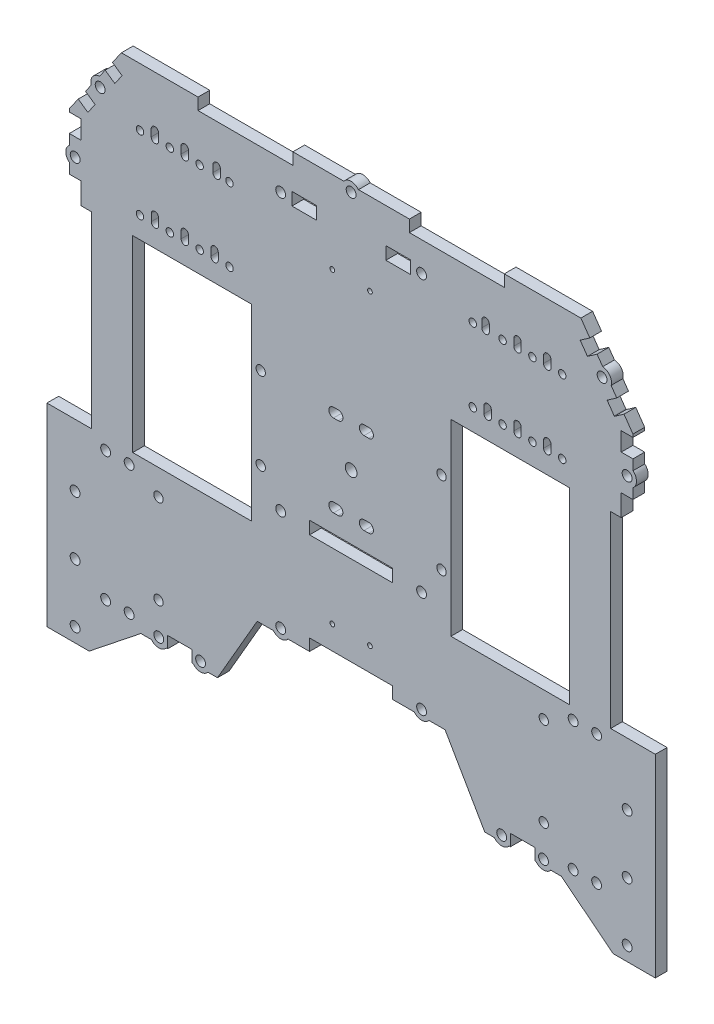
from build123d import *

# Parameters (mm, degrees)
BOSS_EXTRUDE1_DEPTH      = 5
CUT_EXTRUDE1_DEPTH       = 5
CUT_EXTRUDE4_DEPTH       = 5
BOSS_EXTRUDE3_DEPTH      = 5
SKETCH8_R                = 2.1
SKETCH8_W                = 5
SKETCH8_H                = 7.5
SKETCH8_W_2              = 40
SKETCH8_H_2              = 5
CUT_EXTRUDE5_DEPTH       = 10
BOSS_EXTRUDE4_DEPTH      = 5
SKETCH11_W               = 17.5
SKETCH11_H               = 80
BOSS_EXTRUDE5_DEPTH      = 5
CUT_EXTRUDE7_START       = -5
CUT_EXTRUDE7_OUTLINE_W   = 35.4
CUT_EXTRUDE7_OUTLINE_H   = 5
CUT_EXTRUDE7_OUTLINE_W_2 = 10.4
CUT_EXTRUDE7_OUTLINE_W_3 = 35
CUT_EXTRUDE7_DEPTH       = 5
SKETCH14_R               = 2.1
CUT_EXTRUDE8_DEPTH       = 5
SKETCH15_R               = 2.1
CUT_EXTRUDE9_DEPTH       = 5
BOSS_EXTRUDE6_DEPTH      = 5
SKETCH18_W               = 35.4
SKETCH18_H               = 5.4
CUT_EXTRUDE10_DEPTH      = 5
SKETCH20_R               = 2.1
CUT_EXTRUDE12_DEPTH      = 10
BOSS_EXTRUDE7_DEPTH      = 5
SKETCH22_R               = 2.1
CUT_EXTRUDE13_DEPTH      = 10
CUT_EXTRUDE14_START      = -10
SKETCH12_R               = 2.1
SKETCH12_W               = 10.4
SKETCH12_H               = 5.4
SKETCH12_W_2             = 5
SKETCH12_H_2             = 7.9
SKETCH12_W_3             = 40.4
SKETCH12_H_3             = 5
CUT_EXTRUDE14_DEPTH      = 10
SKETCH26_R               = 2.1
CUT_EXTRUDE16_DEPTH      = 10
SKETCH27_R               = 2
CUT_EXTRUDE17_DEPTH      = 10
CUT_EXTRUDE18_START      = -10
CUT_EXTRUDE18_DEPTH      = 10
SKETCH30_R               = 2.5
CUT_EXTRUDE19_DEPTH      = 10
SKETCH32_R               = 1.59
CUT_EXTRUDE20_DEPTH      = 10
SKETCH33_R               = 1
CUT_EXTRUDE21_DEPTH      = 10
SKETCH35_R               = 2
CUT_EXTRUDE22_DEPTH      = 10
SKETCH37_R               = 1.59
CUT_EXTRUDE23_DEPTH      = 10
SKETCH38_R               = 1.59
CUT_EXTRUDE24_DEPTH      = 10
CUT_EXTRUDE25_DEPTH      = 10
SKETCH40_W               = 5
SKETCH40_H               = 1.259948687
CUT_EXTRUDE26_DEPTH      = 10


# Read off the part's stored shape, not the designer's step: Cut-Extrude7
with BuildPart() as part:
    # Sketch1 → Boss-Extrude1 (new body)
    with BuildSketch(Plane.XY):
        Polygon((-120, 40), (-42.5, 40), (-42.5, -40), (-120, -40), (-120, -105), (120, -105), (120, -40), (42.5, -40), (42.5, 40), (120, 40), (120, 105), (-120, 105), align=None)
    extrude(amount=BOSS_EXTRUDE1_DEPTH)

    # Sketch2 → Cut-Extrude1 (cut)
    with BuildSketch(Plane.XY.offset(5)):
        Polygon((40, -75.717967697), (-40, -75.717967697), (-80, -145), (-40, -214.282032303), (40, -214.282032303), (80, -145), align=None)
    extrude(amount=-CUT_EXTRUDE1_DEPTH, mode=Mode.SUBTRACT)

    # Sketch5 → Cut-Extrude4 (cut)
    with BuildSketch(Plane.XY.offset(5)):
        Polygon((-97.823934729, 105), (-120, 73.319897373), (-120, 105), align=None)
        Polygon((97.823934729, 105), (120, 105), (120, 73.319897373), align=None)
    extrude(amount=-CUT_EXTRUDE4_DEPTH, mode=Mode.SUBTRACT)

    # Sketch7 → Boss-Extrude3 (add)
    with BuildSketch(Plane(origin=(0, 0, 0), x_dir=(-1, 0, 0), z_dir=(0, 0, -1))):
        Polygon((120, -40), (120, -105), (89.53, -105), (111.53, -122.5), (129.53, -122.5), (129.53, -40), align=None)
    boss_extrude3 = extrude(amount=-BOSS_EXTRUDE3_DEPTH)

    # Mirror2: Boss-Extrude3 across plane
    add(boss_extrude3.mirror(Plane(origin=(0, 0, 0), x_dir=(0, 0, 1), z_dir=(1, 0, 0))))

    # Sketch8 → Cut-Extrude5 (cut)
    with BuildSketch(Plane.XY.offset(5)):
        with Locations((0, 102.5)):
            Circle(SKETCH8_R)
        with Locations((106.863887364, 87.726293111)):
            Circle(SKETCH8_R)
        with Locations((117.5, 56.659948687)):
            Circle(SKETCH8_R)
        with Locations(Location((-117.5, 56.659948687, 0), (0, 0, 180))):
            Circle(SKETCH8_R)
        with Locations(Location((-106.863887364, 87.726293111, 0), (0, 0, 180))):
            Circle(SKETCH8_R)
        Polygon((-113.212934092, 83.015708684), (-116.080245244, 78.919548683), (-111.984085243, 76.052237531), (-109.116774091, 80.148397532), align=None)
        Polygon((-100.514840635, 92.436877537), (-104.611000637, 95.304188689), (-101.743689485, 99.400348691), (-97.647529483, 96.533037539), align=None)
        with Locations((-117.5, 45.409948687)):
            Rectangle(SKETCH8_W, SKETCH8_H)
        with Locations((-117.5, 67.909948687)):
            Rectangle(SKETCH8_W, SKETCH8_H)
        with Locations((-45, 102.5)):
            Rectangle(SKETCH8_W_2, SKETCH8_H_2)
        with Locations((45, 102.5)):
            Rectangle(SKETCH8_W_2, SKETCH8_H_2)
        with Locations((117.5, 67.909948687)):
            Rectangle(SKETCH8_W, SKETCH8_H)
        with Locations((117.5, 45.409948687)):
            Rectangle(SKETCH8_W, SKETCH8_H)
        Polygon((104.611000637, 95.304188689), (101.743689485, 99.400348691), (97.647529483, 96.533037539), (100.514840635, 92.436877537), align=None)
        Polygon((109.116774091, 80.148397532), (113.212934092, 83.015708684), (116.080245244, 78.919548683), (111.984085243, 76.052237531), align=None)
    extrude(amount=-CUT_EXTRUDE5_DEPTH, mode=Mode.SUBTRACT)

    # Sketch9 → Boss-Extrude4 (add)
    with BuildSketch(Plane.XY.offset(5)):
        with BuildLine():
            Line((-3.122498999, 105), (3.122498999, 105))
            ThreePointArc((3.122498999, 105), (0, 106.5), (-3.122498999, 105))
        make_face()
        with BuildLine():
            Line((107.121332124, 91.717999788), (110.702602605, 86.601897586))
            ThreePointArc((110.702602605, 86.601897586), (110.140815365, 90.020142032), (107.121332124, 91.717999788))
        make_face()
        with BuildLine():
            Line((120, 59.782447686), (120, 53.537449687))
            ThreePointArc((120, 53.537449687), (121.5, 56.659948687), (120, 59.782447686))
        make_face()
        with BuildLine():
            Line((-120, 59.782447686), (-120, 53.537449687))
            ThreePointArc((-120, 53.537449687), (-121.5, 56.659948687), (-120, 59.782447686))
        make_face()
        with BuildLine():
            Line((-107.121332124, 91.717999788), (-110.702602605, 86.601897586))
            ThreePointArc((-110.702602605, 86.601897586), (-110.140815365, 90.020142032), (-107.121332124, 91.717999788))
        make_face()
    extrude(amount=-BOSS_EXTRUDE4_DEPTH)

    # Sketch11 → Boss-Extrude5 (add)
    with BuildSketch(Plane(origin=(0, 0, 0), x_dir=(-1, 0, 0), z_dir=(0, 0, -1))):
        with Locations((101.75, 0)):
            Rectangle(SKETCH11_W, SKETCH11_H)
        with Locations((-101.75, 0)):
            Rectangle(SKETCH11_W, SKETCH11_H)
    extrude(amount=-BOSS_EXTRUDE5_DEPTH)

    # Cut-Extrude7 outline → Cut-Extrude7 (cut)
    with BuildSketch(Plane(origin=(0, 0, 0), x_dir=(-1, 0, 0), z_dir=(0, 0, -1)).offset(CUT_EXTRUDE7_START)):
        with Locations((0, -73.217967697)):
            Rectangle(CUT_EXTRUDE7_OUTLINE_W, CUT_EXTRUDE7_OUTLINE_H)
        with Locations((-73, -102.5)):
            Rectangle(CUT_EXTRUDE7_OUTLINE_W_2, CUT_EXTRUDE7_OUTLINE_H)
        with Locations((73, -102.5)):
            Rectangle(CUT_EXTRUDE7_OUTLINE_W_2, CUT_EXTRUDE7_OUTLINE_H)
        with Locations((0, -30)):
            Rectangle(CUT_EXTRUDE7_OUTLINE_W_3, CUT_EXTRUDE7_OUTLINE_H)
    extrude(amount=CUT_EXTRUDE7_DEPTH, mode=Mode.SUBTRACT)

    # Sketch14 → Cut-Extrude8 (cut)
    with BuildSketch(Plane(origin=(0, 0, 0), x_dir=(-1, 0, 0), z_dir=(0, 0, -1))):
        with Locations((-30, 87.5)):
            Circle(SKETCH14_R)
        with Locations((30, 87.5)):
            Circle(SKETCH14_R)
    extrude(amount=-CUT_EXTRUDE8_DEPTH, mode=Mode.SUBTRACT)

    # Sketch15 → Cut-Extrude9 (cut)
    with BuildSketch(Plane(origin=(0, 0, 0), x_dir=(-1, 0, 0), z_dir=(0, 0, -1))):
        with Locations((30, -73.217967697)):
            Circle(SKETCH15_R)
        with Locations((-30, -73.217967697)):
            Circle(SKETCH15_R)
    extrude(amount=-CUT_EXTRUDE9_DEPTH, mode=Mode.SUBTRACT)

    # Sketch16 → Boss-Extrude6 (add)
    with BuildSketch(Plane(origin=(0, 0, 0), x_dir=(-1, 0, 0), z_dir=(0, 0, -1))):
        with BuildLine():
            Line((-33.122498999, -75.717967697), (-26.877501001, -75.717967697))
            ThreePointArc((-26.877501001, -75.717967697), (-30, -77.217967697), (-33.122498999, -75.717967697))
        make_face()
        with BuildLine():
            Line((26.877501001, -75.717967697), (33.122498999, -75.717967697))
            ThreePointArc((33.122498999, -75.717967697), (30, -77.217967697), (26.877501001, -75.717967697))
        make_face()
    extrude(amount=-BOSS_EXTRUDE6_DEPTH)

    # Sketch18 → Cut-Extrude10 (cut)
    with BuildSketch(Plane(origin=(0, 0, 0), x_dir=(-1, 0, 0), z_dir=(0, 0, -1))):
        with Locations((0, -30)):
            Rectangle(SKETCH18_W, SKETCH18_H)
    extrude(amount=-CUT_EXTRUDE10_DEPTH, mode=Mode.SUBTRACT)

    # Sketch20 → Cut-Extrude12 (cut)
    with BuildSketch(Plane(origin=(0, 0, 0), x_dir=(-1, 0, 0), z_dir=(0, 0, -1))):
        with Locations((-64.1, -102.5)):
            Circle(SKETCH20_R)
        with Locations((-81.9, -102.5)):
            Circle(SKETCH20_R)
        with Locations((81.9, -102.5)):
            Circle(SKETCH20_R)
        with Locations((64.1, -102.5)):
            Circle(SKETCH20_R)
    extrude(amount=-CUT_EXTRUDE12_DEPTH, mode=Mode.SUBTRACT)

    # Sketch21 → Boss-Extrude7 (add)
    with BuildSketch(Plane(origin=(0, 0, 0), x_dir=(-1, 0, 0), z_dir=(0, 0, -1))):
        with BuildLine():
            Line((-85.022498999, -105), (-78.777501001, -105))
            ThreePointArc((-78.777501001, -105), (-81.9, -106.5), (-85.022498999, -105))
        make_face()
        with BuildLine():
            Line((-60.977501001, -105), (-67.222498999, -105))
            ThreePointArc((-67.222498999, -105), (-64.1, -106.5), (-60.977501001, -105))
        make_face()
        with BuildLine():
            Line((60.977501001, -105), (67.222498999, -105))
            ThreePointArc((67.222498999, -105), (64.1, -106.5), (60.977501001, -105))
        make_face()
        with BuildLine():
            Line((85.022498999, -105), (78.777501001, -105))
            ThreePointArc((78.777501001, -105), (81.9, -106.5), (85.022498999, -105))
        make_face()
    extrude(amount=-BOSS_EXTRUDE7_DEPTH)

    # Sketch22 → Cut-Extrude13 (cut)
    with BuildSketch(Plane(origin=(0, 0, 0), x_dir=(-1, 0, 0), z_dir=(0, 0, -1))):
        with Locations((-30, -30)):
            Circle(SKETCH22_R)
        with Locations((30, -30)):
            Circle(SKETCH22_R)
    extrude(amount=-CUT_EXTRUDE13_DEPTH, mode=Mode.SUBTRACT)

    # Sketch12 → Cut-Extrude14 (cut)
    with BuildSketch(Plane(origin=(0, 0, 0), x_dir=(-1, 0, 0), z_dir=(0, 0, -1)).offset(CUT_EXTRUDE14_START)):
        with Locations(Location((-117.5, 56.659948687, 0), (0, 0, 180))):
            Circle(SKETCH12_R)
        with Locations((117.5, 56.659948687)):
            Circle(SKETCH12_R)
        with Locations((-20, 87.5)):
            Rectangle(SKETCH12_W, SKETCH12_H)
        with Locations((20, 87.5)):
            Rectangle(SKETCH12_W, SKETCH12_H)
        with Locations((-117.5, 68.109948687)):
            Rectangle(SKETCH12_W_2, SKETCH12_H_2)
        with Locations((-117.5, 45.209948687)):
            Rectangle(SKETCH12_W_2, SKETCH12_H_2)
        Polygon((-101.628998624, 99.564192826), (-97.532838623, 96.696881674), (-100.629534667, 92.273028872), (-104.725694668, 95.140340024), align=None)
        with Locations((117.5, 45.209948687)):
            Rectangle(SKETCH12_W_2, SKETCH12_H_2)
        Polygon((-113.098249115, 83.179569765), (-116.194953969, 78.75572313), (-112.098799678, 75.888403821), (-109.002094824, 80.312250455), align=None)
        with Locations((-45, 102.5)):
            Rectangle(SKETCH12_W_3, SKETCH12_H_3)
        with Locations((45, 102.5)):
            Rectangle(SKETCH12_W_3, SKETCH12_H_3)
        with Locations((117.5, 68.109948687)):
            Rectangle(SKETCH12_W_2, SKETCH12_H_2)
        Polygon((116.194953969, 78.75572313), (112.098799678, 75.888403821), (109.002094824, 80.312250455), (113.098249115, 83.179569765), align=None)
        Polygon((104.725694668, 95.140340024), (101.628998624, 99.564192826), (97.532838623, 96.696881674), (100.629534667, 92.273028872), align=None)
    extrude(amount=CUT_EXTRUDE14_DEPTH, mode=Mode.SUBTRACT)

    # Sketch26 → Cut-Extrude16 (cut)
    with BuildSketch(Plane.XY.offset(5)):
        with Locations((-104.53, -100)):
            Circle(SKETCH26_R)
        with Locations((-94.53, -100)):
            Circle(SKETCH26_R)
        with Locations((-117.53, -116.5)):
            Circle(SKETCH26_R)
        with Locations((-117.53, -91.5)):
            Circle(SKETCH26_R)
        with Locations((-117.53, -66.5)):
            Circle(SKETCH26_R)
        with Locations((-104.53, -45)):
            Circle(SKETCH26_R)
        with Locations((-94.53, -45)):
            Circle(SKETCH26_R)
    cut_extrude16 = extrude(amount=-CUT_EXTRUDE16_DEPTH, mode=Mode.SUBTRACT)

    # Mirror3: Cut-Extrude16 across plane
    add(cut_extrude16.mirror(Plane(origin=(0, 0, 0), x_dir=(0, 0, 1), z_dir=(1, 0, 0))), mode=Mode.SUBTRACT)

    # Sketch27 → Cut-Extrude17 (cut)
    with BuildSketch(Plane.XY.offset(5)):
        with Locations((7.5, 17.5)):
            Circle(SKETCH27_R)
        with Locations((38.5, 17.5)):
            Circle(SKETCH27_R)
        with Locations((38.5, -17.5)):
            Circle(SKETCH27_R)
        with Locations((7.5, -17.5)):
            Circle(SKETCH27_R)
    cut_extrude17 = extrude(amount=-CUT_EXTRUDE17_DEPTH, mode=Mode.SUBTRACT)

    # Mirror4: Cut-Extrude17 across plane
    add(cut_extrude17.mirror(Plane(origin=(0, 0, 0), x_dir=(0, 0, 1), z_dir=(1, 0, 0))), mode=Mode.SUBTRACT)

    # Sketch29 → Cut-Extrude18 (cut)
    with BuildSketch(Plane(origin=(0, 0, 0), x_dir=(-1, 0, 0), z_dir=(0, 0, -1)).offset(CUT_EXTRUDE18_START)):
        with BuildLine():
            Line((5.5, 19.5), (7.5, 19.5))
            ThreePointArc((7.5, 19.5), (9.5, 17.5), (7.5, 15.5))
            Line((7.5, 15.5), (5.5, 15.5))
            ThreePointArc((5.5, 15.5), (3.5, 17.5), (5.5, 19.5))
        make_face()
        with BuildLine():
            Line((-7.5, 15.5), (-5.5, 15.5))
            ThreePointArc((-5.5, 15.5), (-3.5, 17.5), (-5.5, 19.5))
            Line((-5.5, 19.5), (-7.5, 19.5))
            ThreePointArc((-7.5, 19.5), (-9.5, 17.5), (-7.5, 15.5))
        make_face()
        with BuildLine():
            Line((-5.5, -19.5), (-7.5, -19.5))
            ThreePointArc((-7.5, -19.5), (-9.5, -17.5), (-7.5, -15.5))
            Line((-7.5, -15.5), (-5.5, -15.5))
            ThreePointArc((-5.5, -15.5), (-3.5, -17.5), (-5.5, -19.5))
        make_face()
        with BuildLine():
            Line((7.5, -15.5), (5.5, -15.5))
            ThreePointArc((5.5, -15.5), (3.5, -17.5), (5.5, -19.5))
            Line((5.5, -19.5), (7.5, -19.5))
            ThreePointArc((7.5, -19.5), (9.5, -17.5), (7.5, -15.5))
        make_face()
    extrude(amount=CUT_EXTRUDE18_DEPTH, mode=Mode.SUBTRACT)

    # Sketch30 → Cut-Extrude19 (cut)
    with BuildSketch(Plane(origin=(0, 0, 0), x_dir=(-1, 0, 0), z_dir=(0, 0, -1))):
        Circle(SKETCH30_R)
    extrude(amount=-CUT_EXTRUDE19_DEPTH, mode=Mode.SUBTRACT)

    # Sketch32 → Cut-Extrude20 (cut)
    with BuildSketch(Plane.XY.offset(5)):
        with Locations((89.89, 80.32)):
            Circle(SKETCH32_R)
        with Locations((77.19, 80.32)):
            Circle(SKETCH32_R)
        with Locations((64.49, 80.32)):
            Circle(SKETCH32_R)
        with Locations(Location((64.49, 49.08, 0), (0, 0, 180))):
            Circle(SKETCH32_R)
        with Locations(Location((77.19, 49.08, 0), (0, 0, 180))):
            Circle(SKETCH32_R)
        with Locations(Location((89.89, 49.08, 0), (0, 0, 180))):
            Circle(SKETCH32_R)
        with Locations((-89.89, 49.08)):
            Circle(SKETCH32_R)
        with Locations((-77.19, 49.08)):
            Circle(SKETCH32_R)
        with Locations((-64.49, 49.08)):
            Circle(SKETCH32_R)
        with Locations(Location((-64.49, 80.32, 0), (0, 0, 180))):
            Circle(SKETCH32_R)
        with Locations(Location((-77.19, 80.32, 0), (0, 0, 180))):
            Circle(SKETCH32_R)
        with Locations(Location((-89.89, 80.32, 0), (0, 0, 180))):
            Circle(SKETCH32_R)
    extrude(amount=-CUT_EXTRUDE20_DEPTH, mode=Mode.SUBTRACT)

    # Sketch33 → Cut-Extrude21 (cut)
    with BuildSketch(Plane.XY.offset(5)):
        with Locations((8, 70)):
            Circle(SKETCH33_R)
        with Locations((-8, 70)):
            Circle(SKETCH33_R)
        with Locations(Location((-8, -60.717967697, 0), (0, 0, 180))):
            Circle(SKETCH33_R)
        with Locations(Location((8, -60.717967697, 0), (0, 0, 180))):
            Circle(SKETCH33_R)
    extrude(amount=-CUT_EXTRUDE21_DEPTH, mode=Mode.SUBTRACT)

    # Sketch35 → Cut-Extrude22 (cut)
    with BuildSketch(Plane.XY.offset(5)):
        with Locations((-82.03, -50.912445244)):
            Circle(SKETCH35_R)
        with Locations((-82.03, -88.912445244)):
            Circle(SKETCH35_R)
        with Locations((82.03, -88.912445244)):
            Circle(SKETCH35_R)
        with Locations((82.03, -50.912445244)):
            Circle(SKETCH35_R)
    extrude(amount=-CUT_EXTRUDE22_DEPTH, mode=Mode.SUBTRACT)

    # Sketch37 → Cut-Extrude23 (cut)
    with BuildSketch(Plane.XY.offset(5)):
        with Locations((64.49, 80.32)):
            Circle(SKETCH37_R)
        with Locations((77.19, 80.32)):
            Circle(SKETCH37_R)
        with Locations(Location((64.49, 49.08, 0), (0, 0, 180))):
            Circle(SKETCH37_R)
        with BuildLine():
            ThreePointArc((50.2, 49.08), (51.7875, 47.4925), (53.375, 49.08))
            ThreePointArc((53.375, 49.08), (51.7875, 50.6675), (50.2, 49.08))
        make_face()
        with BuildLine():
            ThreePointArc((52.823020743, 79.116732348), (52.449416562, 81.76292159), (50.2, 80.32))
            ThreePointArc((50.2, 80.32), (51.125583438, 78.87707841), (52.823020743, 79.116732348))
        make_face()
    cut_extrude23 = extrude(amount=-CUT_EXTRUDE23_DEPTH, mode=Mode.SUBTRACT)

    # Mirror5: Cut-Extrude23 across plane
    add(cut_extrude23.mirror(Plane(origin=(0, 0, 0), x_dir=(0, 0, 1), z_dir=(1, 0, 0))), mode=Mode.SUBTRACT)

    # Sketch38 → Cut-Extrude24 (cut)
    with BuildSketch(Plane.XY.offset(5)):
        with Locations((89.89, 80.32)):
            Circle(SKETCH38_R)
        with BuildLine():
            Line((55.653884034, 83.32), (55.653884034, 80.32))
            ThreePointArc((55.653884034, 80.32), (57.241384034, 78.7325), (58.828884034, 80.32))
            Line((58.828884034, 80.32), (58.828884034, 83.32))
            ThreePointArc((58.828884034, 83.32), (57.241384034, 84.9075), (55.653884034, 83.32))
        make_face()
        with BuildLine():
            Line((69.249996396, 83.32), (69.249996396, 80.326693935))
            ThreePointArc((69.249996396, 80.326693935), (70.837496396, 78.732485887), (72.424996396, 80.326693935))
            Line((72.424996396, 80.326693935), (72.424996396, 83.32))
            ThreePointArc((72.424996396, 83.32), (70.837496396, 84.9075), (69.249996396, 83.32))
        make_face()
        with BuildLine():
            Line((81.9525, 83.32), (81.9525, 80.326693935))
            ThreePointArc((81.9525, 80.326693935), (83.54, 78.732485887), (85.1275, 80.326693935))
            Line((85.1275, 80.326693935), (85.1275, 83.32))
            ThreePointArc((85.1275, 83.32), (83.54, 84.9075), (81.9525, 83.32))
        make_face()
    cut_extrude24 = extrude(amount=-CUT_EXTRUDE24_DEPTH, mode=Mode.SUBTRACT)

    # Mirror6: Cut-Extrude24 across plane
    add(cut_extrude24.mirror(Plane(origin=(0, 0, 0), x_dir=(0, 0, 1), z_dir=(1, 0, 0))), mode=Mode.SUBTRACT)

    # Sketch39 → Cut-Extrude25 (cut)
    with BuildSketch(Plane.XY.offset(5)):
        with BuildLine():
            Line((81.974373255, 49.08), (81.974373255, 52.08))
            ThreePointArc((81.974373255, 52.08), (83.54, 53.645626745), (85.105626745, 52.08))
            Line((85.105626745, 52.08), (85.105626745, 49.08))
            ThreePointArc((85.105626745, 49.08), (83.54, 47.514373255), (81.974373255, 49.08))
        make_face()
        with BuildLine():
            Line((72.405626745, 49.08), (72.405626745, 52.08))
            ThreePointArc((72.405626745, 52.08), (70.84, 53.645626745), (69.274373255, 52.08))
            Line((69.274373255, 52.08), (69.274373255, 49.08))
            ThreePointArc((69.274373255, 49.08), (70.84, 47.514373255), (72.405626745, 49.08))
        make_face()
        with BuildLine():
            Line((56.574373255, 49.08), (56.574373255, 52.08))
            ThreePointArc((56.574373255, 52.08), (58.14, 53.645626745), (59.705626745, 52.08))
            Line((59.705626745, 52.08), (59.705626745, 49.08))
            ThreePointArc((59.705626745, 49.08), (58.14, 47.514373255), (56.574373255, 49.08))
        make_face()
        with BuildLine():
            Line((-56.574373255, 49.08), (-56.574373255, 52.08))
            ThreePointArc((-56.574373255, 52.08), (-58.14, 53.645626745), (-59.705626745, 52.08))
            Line((-59.705626745, 52.08), (-59.705626745, 49.08))
            ThreePointArc((-59.705626745, 49.08), (-58.14, 47.514373255), (-56.574373255, 49.08))
        make_face()
        with BuildLine():
            Line((-72.405626745, 49.08), (-72.405626745, 52.08))
            ThreePointArc((-72.405626745, 52.08), (-70.84, 53.645626745), (-69.274373255, 52.08))
            Line((-69.274373255, 52.08), (-69.274373255, 49.08))
            ThreePointArc((-69.274373255, 49.08), (-70.84, 47.514373255), (-72.405626745, 49.08))
        make_face()
        with BuildLine():
            Line((-81.974373255, 49.08), (-81.974373255, 52.08))
            ThreePointArc((-81.974373255, 52.08), (-83.54, 53.645626745), (-85.105626745, 52.08))
            Line((-85.105626745, 52.08), (-85.105626745, 49.08))
            ThreePointArc((-85.105626745, 49.08), (-83.54, 47.514373255), (-81.974373255, 49.08))
        make_face()
    extrude(amount=-CUT_EXTRUDE25_DEPTH, mode=Mode.SUBTRACT)

    # Sketch40 → Cut-Extrude26 (cut)
    with BuildSketch(Plane(origin=(0, 0, 0), x_dir=(-1, 0, 0), z_dir=(0, 0, -1))):
        with Locations((-117.5, 40.629974344)):
            Rectangle(SKETCH40_W, SKETCH40_H)
        with Locations((117.5, 40.629974344)):
            Rectangle(SKETCH40_W, SKETCH40_H)
    extrude(amount=-CUT_EXTRUDE26_DEPTH, mode=Mode.SUBTRACT)


solid = part.part
